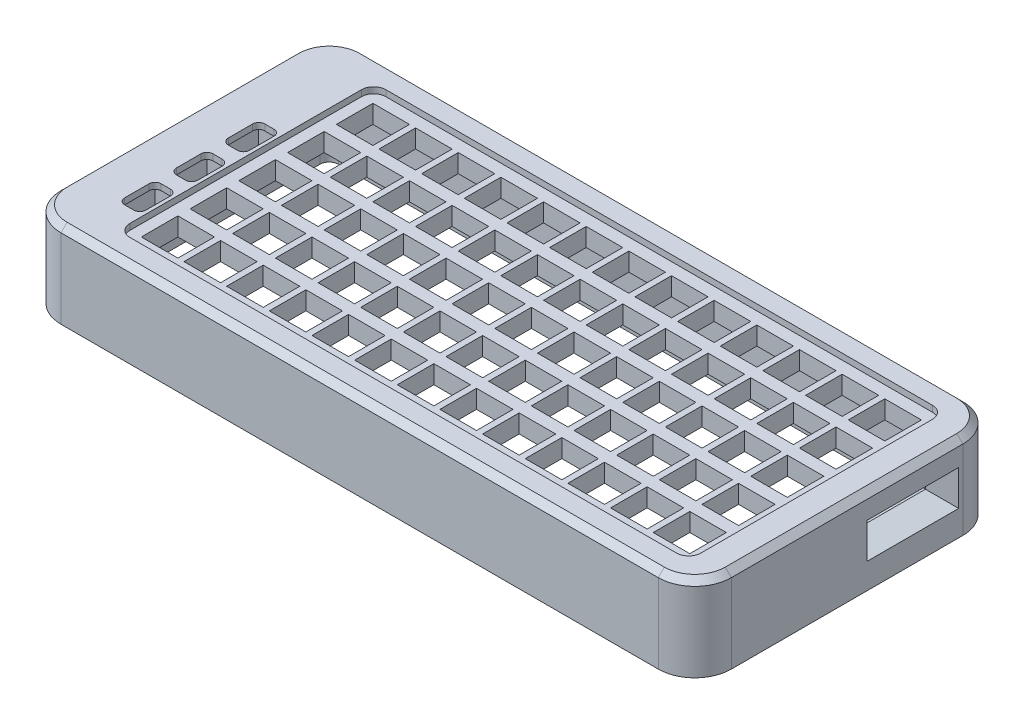
from build123d import *

# Parameters (mm, degrees)
SKETCH_1_W          = 110
SKETCH_1_H          = 50
EXTRUDE_1_DEPTH     = 3
SKETCH_2_W          = 6
SKETCH_2_H          = 6
CUT_EXTRUDE_1_DEPTH = 10
SKETCH_3_W          = 110
SKETCH_3_H          = 50
SKETCH_3_W_2        = 93.7
SKETCH_3_H_2        = 42
EXTRUDE_2_DEPTH     = 1
FILLET_1_R          = 6
CUT_EXTRUDE_2_DEPTH = 6
SKETCH_5_W          = 4.5
SKETCH_5_H          = 7
CUT_EXTRUDE_3_DEPTH = 3
FILLET_2_R          = 2
CHAMFER_1_SIZE      = 1
EXTRUDE_3_DEPTH     = 10
CUT_EXTRUDE_4_DEPTH = 7
CUT_EXTRUDE_5_DEPTH = 3.5
SKETCH_10_W         = 12.104271825
SKETCH_10_H         = 2.912306003
CUT_EXTRUDE_6_DEPTH = 6.5
CHAMFER_2_SIZE      = 4
CHAMFER_2_SIZE2     = 1.455880937
CHAMFER_3_SIZE      = 4
CHAMFER_3_SIZE2     = 1.455880937
CHAMFER_4_SIZE      = 4
CHAMFER_4_SIZE2     = 1.455880937
CHAMFER_5_SIZE      = 4
CHAMFER_5_SIZE2     = 1.455880937
SKETCH_11_R         = 1.55
CUT_EXTRUDE_7_DEPTH = 2


with BuildPart() as part:
    # 草图1 → 凸台-拉伸1 (new body)
    with BuildSketch(Plane(origin=(0, 0, 0), x_dir=(1, 0, 0), z_dir=(0, 1, 0))):
        Rectangle(SKETCH_1_W, SKETCH_1_H)
    extrude(amount=EXTRUDE_1_DEPTH)

    # 草图2 → 切除-拉伸1 (cut)
    with BuildSketch(Plane.XZ):
        with Locations((45.1750889, 8.00003429)):
            Rectangle(SKETCH_2_W, SKETCH_2_H)
        with Locations((45.1750889, 16.00003429)):
            Rectangle(SKETCH_2_W, SKETCH_2_H)
        with Locations((45.1750889, 3.429e-05)):
            Rectangle(SKETCH_2_W, SKETCH_2_H)
        with Locations((45.1750889, -7.99996571)):
            Rectangle(SKETCH_2_W, SKETCH_2_H)
        with Locations((45.1750889, -15.99996571)):
            Rectangle(SKETCH_2_W, SKETCH_2_H)
        with Locations((38.1750889, 8.00003429)):
            Rectangle(SKETCH_2_W, SKETCH_2_H)
        with Locations((38.1750889, 3.429e-05)):
            Rectangle(SKETCH_2_W, SKETCH_2_H)
        with Locations((38.1750889, -7.99996571)):
            Rectangle(SKETCH_2_W, SKETCH_2_H)
        with Locations((38.1750889, -15.99996571)):
            Rectangle(SKETCH_2_W, SKETCH_2_H)
        with Locations((31.1750889, 8.00003429)):
            Rectangle(SKETCH_2_W, SKETCH_2_H)
        with Locations((31.1750889, 3.429e-05)):
            Rectangle(SKETCH_2_W, SKETCH_2_H)
        with Locations((31.1750889, -7.99996571)):
            Rectangle(SKETCH_2_W, SKETCH_2_H)
        with Locations((31.1750889, -15.99996571)):
            Rectangle(SKETCH_2_W, SKETCH_2_H)
        with Locations((24.1750889, 8.00003429)):
            Rectangle(SKETCH_2_W, SKETCH_2_H)
        with Locations((24.1750889, 3.429e-05)):
            Rectangle(SKETCH_2_W, SKETCH_2_H)
        with Locations((24.1750889, -7.99996571)):
            Rectangle(SKETCH_2_W, SKETCH_2_H)
        with Locations((24.1750889, -15.99996571)):
            Rectangle(SKETCH_2_W, SKETCH_2_H)
        with Locations((17.1750889, 8.00003429)):
            Rectangle(SKETCH_2_W, SKETCH_2_H)
        with Locations((17.1750889, 3.429e-05)):
            Rectangle(SKETCH_2_W, SKETCH_2_H)
        with Locations((17.1750889, -7.99996571)):
            Rectangle(SKETCH_2_W, SKETCH_2_H)
        with Locations((17.1750889, -15.99996571)):
            Rectangle(SKETCH_2_W, SKETCH_2_H)
        with Locations((10.1750889, 8.00003429)):
            Rectangle(SKETCH_2_W, SKETCH_2_H)
        with Locations((10.1750889, 3.429e-05)):
            Rectangle(SKETCH_2_W, SKETCH_2_H)
        with Locations((10.1750889, -7.99996571)):
            Rectangle(SKETCH_2_W, SKETCH_2_H)
        with Locations((10.1750889, -15.99996571)):
            Rectangle(SKETCH_2_W, SKETCH_2_H)
        with Locations((3.1750889, 8.00003429)):
            Rectangle(SKETCH_2_W, SKETCH_2_H)
        with Locations((3.1750889, 3.429e-05)):
            Rectangle(SKETCH_2_W, SKETCH_2_H)
        with Locations((3.1750889, -7.99996571)):
            Rectangle(SKETCH_2_W, SKETCH_2_H)
        with Locations((3.1750889, -15.99996571)):
            Rectangle(SKETCH_2_W, SKETCH_2_H)
        with Locations((-3.8249111, 8.00003429)):
            Rectangle(SKETCH_2_W, SKETCH_2_H)
        with Locations((-3.8249111, 3.429e-05)):
            Rectangle(SKETCH_2_W, SKETCH_2_H)
        with Locations((-3.8249111, -7.99996571)):
            Rectangle(SKETCH_2_W, SKETCH_2_H)
        with Locations((-3.8249111, -15.99996571)):
            Rectangle(SKETCH_2_W, SKETCH_2_H)
        with Locations((-10.8249111, 8.00003429)):
            Rectangle(SKETCH_2_W, SKETCH_2_H)
        with Locations((-10.8249111, 3.429e-05)):
            Rectangle(SKETCH_2_W, SKETCH_2_H)
        with Locations((-10.8249111, -7.99996571)):
            Rectangle(SKETCH_2_W, SKETCH_2_H)
        with Locations((-10.8249111, -15.99996571)):
            Rectangle(SKETCH_2_W, SKETCH_2_H)
        with Locations((-17.8249111, 8.00003429)):
            Rectangle(SKETCH_2_W, SKETCH_2_H)
        with Locations((-17.8249111, 3.429e-05)):
            Rectangle(SKETCH_2_W, SKETCH_2_H)
        with Locations((-17.8249111, -7.99996571)):
            Rectangle(SKETCH_2_W, SKETCH_2_H)
        with Locations((-17.8249111, -15.99996571)):
            Rectangle(SKETCH_2_W, SKETCH_2_H)
        with Locations((-24.8249111, 8.00003429)):
            Rectangle(SKETCH_2_W, SKETCH_2_H)
        with Locations((-24.8249111, 3.429e-05)):
            Rectangle(SKETCH_2_W, SKETCH_2_H)
        with Locations((-24.8249111, -7.99996571)):
            Rectangle(SKETCH_2_W, SKETCH_2_H)
        with Locations((-24.8249111, -15.99996571)):
            Rectangle(SKETCH_2_W, SKETCH_2_H)
        with Locations((-31.8249111, 8.00003429)):
            Rectangle(SKETCH_2_W, SKETCH_2_H)
        with Locations((-31.8249111, 3.429e-05)):
            Rectangle(SKETCH_2_W, SKETCH_2_H)
        with Locations((-31.8249111, -7.99996571)):
            Rectangle(SKETCH_2_W, SKETCH_2_H)
        with Locations((-31.8249111, -15.99996571)):
            Rectangle(SKETCH_2_W, SKETCH_2_H)
        with Locations((-38.8249111, 8.00003429)):
            Rectangle(SKETCH_2_W, SKETCH_2_H)
        with Locations((-38.8249111, 3.429e-05)):
            Rectangle(SKETCH_2_W, SKETCH_2_H)
        with Locations((-38.8249111, -7.99996571)):
            Rectangle(SKETCH_2_W, SKETCH_2_H)
        with Locations((-38.8249111, -15.99996571)):
            Rectangle(SKETCH_2_W, SKETCH_2_H)
        with Locations((38.1750889, 16.00003429)):
            Rectangle(SKETCH_2_W, SKETCH_2_H)
        with Locations((31.1750889, 16.00003429)):
            Rectangle(SKETCH_2_W, SKETCH_2_H)
        with Locations((24.1750889, 16.00003429)):
            Rectangle(SKETCH_2_W, SKETCH_2_H)
        with Locations((17.1750889, 16.00003429)):
            Rectangle(SKETCH_2_W, SKETCH_2_H)
        with Locations((10.1750889, 16.00003429)):
            Rectangle(SKETCH_2_W, SKETCH_2_H)
        with Locations((3.1750889, 16.00003429)):
            Rectangle(SKETCH_2_W, SKETCH_2_H)
        with Locations((-3.8249111, 16.00003429)):
            Rectangle(SKETCH_2_W, SKETCH_2_H)
        with Locations((-10.8249111, 16.00003429)):
            Rectangle(SKETCH_2_W, SKETCH_2_H)
        with Locations((-17.8249111, 16.00003429)):
            Rectangle(SKETCH_2_W, SKETCH_2_H)
        with Locations((-24.8249111, 16.00003429)):
            Rectangle(SKETCH_2_W, SKETCH_2_H)
        with Locations((-31.8249111, 16.00003429)):
            Rectangle(SKETCH_2_W, SKETCH_2_H)
        with Locations((-38.8249111, 16.00003429)):
            Rectangle(SKETCH_2_W, SKETCH_2_H)
    extrude(amount=-CUT_EXTRUDE_1_DEPTH, mode=Mode.SUBTRACT)

    # 草图3 → 凸台-拉伸2 (add)
    with BuildSketch(Plane(origin=(0, 3, 0), x_dir=(1, 0, 0), z_dir=(0, 1, 0))):
        Rectangle(SKETCH_3_W, SKETCH_3_H)
        with Locations((3.15, 0)):
            Rectangle(SKETCH_3_W_2, SKETCH_3_H_2, mode=Mode.SUBTRACT)
    extrude(amount=EXTRUDE_2_DEPTH)

    # 圆角1
    fillet_1_edges = [part.edges().sort_by_distance(p)[0] for p in [
        (-55, 2, -25),
        (-55, 2, 25),
        (55, 2, 25),
        (55, 2, -25),
    ]]
    fillet(fillet_1_edges, radius=FILLET_1_R)

    # 草图4 → 切除-拉伸2 (cut)
    with BuildSketch(Plane.XZ):
        with BuildLine():
            Line((-45.261201687, -0.20000635), (-46.761201687, -0.20000635))
            ThreePointArc((-46.761201687, -0.20000635), (-47.468308468, -0.492899569), (-47.761201687, -1.20000635))
            Line((-47.761201687, -1.20000635), (-47.761201687, -5.20000635))
            ThreePointArc((-47.761201687, -5.20000635), (-47.468308468, -5.907113131), (-46.761201687, -6.20000635))
            Line((-46.761201687, -6.20000635), (-45.261201687, -6.20000635))
            ThreePointArc((-45.261201687, -6.20000635), (-44.554094906, -5.907113131), (-44.261201687, -5.20000635))
            Line((-44.261201687, -5.20000635), (-44.261201687, -1.20000635))
            ThreePointArc((-44.261201687, -1.20000635), (-44.554094906, -0.492899569), (-45.261201687, -0.20000635))
        make_face()
        with BuildLine():
            Line((-44.261201687, 7.29999365), (-44.261201687, 3.29999365))
            ThreePointArc((-44.261201687, 3.29999365), (-44.554094906, 2.592886869), (-45.261201687, 2.29999365))
            Line((-45.261201687, 2.29999365), (-46.761201687, 2.29999365))
            ThreePointArc((-46.761201687, 2.29999365), (-47.468308468, 2.592886869), (-47.761201687, 3.29999365))
            Line((-47.761201687, 3.29999365), (-47.761201687, 7.29999365))
            ThreePointArc((-47.761201687, 7.29999365), (-47.468308468, 8.007100431), (-46.761201687, 8.29999365))
            Line((-46.761201687, 8.29999365), (-45.261201687, 8.29999365))
            ThreePointArc((-45.261201687, 8.29999365), (-44.554094906, 8.007100431), (-44.261201687, 7.29999365))
        make_face()
        with BuildLine():
            Line((-44.261201687, 15.79999365), (-44.261201687, 11.79999365))
            ThreePointArc((-44.261201687, 11.79999365), (-44.554094906, 11.092886869), (-45.261201687, 10.79999365))
            Line((-45.261201687, 10.79999365), (-46.761201687, 10.79999365))
            ThreePointArc((-46.761201687, 10.79999365), (-47.468308468, 11.092886869), (-47.761201687, 11.79999365))
            Line((-47.761201687, 11.79999365), (-47.761201687, 15.79999365))
            ThreePointArc((-47.761201687, 15.79999365), (-47.468308468, 16.507100431), (-46.761201687, 16.79999365))
            Line((-46.761201687, 16.79999365), (-45.261201687, 16.79999365))
            ThreePointArc((-45.261201687, 16.79999365), (-44.554094906, 16.507100431), (-44.261201687, 15.79999365))
        make_face()
    extrude(amount=-CUT_EXTRUDE_2_DEPTH, mode=Mode.SUBTRACT)

    # 草图5 → 切除-拉伸3 (cut)
    with BuildSketch(Plane.XZ):
        with Locations((-46.011201687, 5.29999365)):
            Rectangle(SKETCH_5_W, SKETCH_5_H)
        with Locations((-46.011201687, -3.20000635)):
            Rectangle(SKETCH_5_W, SKETCH_5_H)
        with Locations((-46.011201687, 13.79999365)):
            Rectangle(SKETCH_5_W, SKETCH_5_H)
    extrude(amount=-CUT_EXTRUDE_3_DEPTH, mode=Mode.SUBTRACT)

    # 圆角2
    fillet_2_edges = [part.edges().sort_by_distance(p)[0] for p in [
        (50, 3.5, 21),
        (50, 3.5, -21),
        (-43.7, 3.5, -21),
        (-43.7, 3.5, 21),
    ]]
    fillet(fillet_2_edges, radius=FILLET_2_R)

    # 倒角1
    chamfer_1_edges = [part.edges().sort_by_distance(p)[0] for p in [
        (53.242640687, 4, -23.242640687),
        (0, 4, -25),
        (55, 4, 0),
        (-53.242640687, 4, -23.242640687),
        (53.242640687, 4, 23.242640687),
        (-55, 4, 0),
        (0, 4, 25),
        (-53.242640687, 4, 23.242640687),
    ]]
    chamfer(chamfer_1_edges, length=CHAMFER_1_SIZE)

    # 草图6 → 凸台-拉伸3 (add)
    with BuildSketch(Plane.XZ):
        with BuildLine():
            Line((-55, 19), (-55, -19))
            ThreePointArc((-55, -19), (-53.242640687, -23.242640687), (-49, -25))
            Line((-49, -25), (49, -25))
            ThreePointArc((49, -25), (53.242640687, -23.242640687), (55, -19))
            Line((55, -19), (55, 19))
            ThreePointArc((55, 19), (53.242640687, 23.242640687), (49, 25))
            Line((49, 25), (-49, 25))
            ThreePointArc((-49, 25), (-53.242640687, 23.242640687), (-55, 19))
        make_face()
        with BuildLine():
            Line((50.5, 19), (50.5, -19))
            ThreePointArc((50.5, -19), (50.060660172, -20.060660172), (49, -20.5))
            Line((49, -20.5), (-49, -20.5))
            ThreePointArc((-49, -20.5), (-50.060660172, -20.060660172), (-50.5, -19))
            Line((-50.5, -19), (-50.5, 19))
            ThreePointArc((-50.5, 19), (-50.060660172, 20.060660172), (-49, 20.5))
            Line((-49, 20.5), (49, 20.5))
            ThreePointArc((49, 20.5), (50.060660172, 20.060660172), (50.5, 19))
        make_face(mode=Mode.SUBTRACT)
    extrude(amount=EXTRUDE_3_DEPTH)

    # 草图8 → 切除-拉伸4 (cut)
    with BuildSketch(Plane(origin=(-50.5, 0, 0), x_dir=(0, 0, -1), z_dir=(1, 0, 0))):
        with BuildLine():
            Line((14.684129805, -5.028501584), (8.683914391, -5.028501584))
            ThreePointArc((8.683914391, -5.028501584), (6.935463557, -3.28005075), (8.683914391, -1.531599916))
            Line((8.683914391, -1.531599916), (14.684129805, -1.531599916))
            ThreePointArc((14.684129805, -1.531599916), (16.432580639, -3.28005075), (14.684129805, -5.028501584))
        make_face()
    extrude(amount=-CUT_EXTRUDE_4_DEPTH, mode=Mode.SUBTRACT)

    # 草图9 → 切除-拉伸5 (cut)
    with BuildSketch(Plane.ZY.offset(55)):
        with BuildLine():
            Line((-15.088320827, -0.03005075), (-8.279723369, -0.03005075))
            ThreePointArc((-8.279723369, -0.03005075), (-5.029723369, -3.28005075), (-8.279723369, -6.53005075))
            Line((-8.279723369, -6.53005075), (-15.088320827, -6.53005075))
            ThreePointArc((-15.088320827, -6.53005075), (-18.338320827, -3.28005075), (-15.088320827, -0.03005075))
        make_face()
    extrude(amount=-CUT_EXTRUDE_5_DEPTH, mode=Mode.SUBTRACT)

    # 草图10 → 切除-拉伸6 (cut)
    with BuildSketch(Plane.ZY.offset(-50.5)):
        with Locations((-10.796340626, -2.900297793)):
            Rectangle(SKETCH_10_W, SKETCH_10_H)
    extrude(amount=-CUT_EXTRUDE_6_DEPTH, mode=Mode.SUBTRACT)

    # 倒角2
    chamfer_2_edges = [part.edges().sort_by_distance(p)[0] for p in [
        (55, -1.444144791, -10.796340625),
    ]]
    chamfer_2_side = [part.faces().sort_by_distance(p)[0] for p in [
        (52.75, -1.444144791, -10.796340625),
    ]]
    chamfer(chamfer_2_edges, length=CHAMFER_2_SIZE, length2=CHAMFER_2_SIZE2, reference=chamfer_2_side[0])

    # 倒角3
    chamfer_3_edges = [part.edges().sort_by_distance(p)[0] for p in [
        (55, -4.356450794, -10.796340625),
    ]]
    chamfer_3_side = [part.faces().sort_by_distance(p)[0] for p in [
        (52.75, -4.356450794, -10.796340625),
    ]]
    chamfer(chamfer_3_edges, length=CHAMFER_3_SIZE, length2=CHAMFER_3_SIZE2, reference=chamfer_3_side[0])

    # 倒角4
    chamfer_4_edges = [part.edges().sort_by_distance(p)[0] for p in [
        (55, -2.900297793, -4.744204713),
    ]]
    chamfer_4_side = [part.faces().sort_by_distance(p)[0] for p in [
        (53.032014797, -2.900297793, -4.744204713),
    ]]
    chamfer(chamfer_4_edges, length=CHAMFER_4_SIZE, length2=CHAMFER_4_SIZE2, reference=chamfer_4_side[0])

    # 倒角5
    chamfer_5_edges = [part.edges().sort_by_distance(p)[0] for p in [
        (55, -2.900297793, -16.848476538),
    ]]
    chamfer_5_side = [part.faces().sort_by_distance(p)[0] for p in [
        (53.032014797, -2.900297793, -16.848476538),
    ]]
    chamfer(chamfer_5_edges, length=CHAMFER_5_SIZE, length2=CHAMFER_5_SIZE2, reference=chamfer_5_side[0])

    # 草图11 → 切除-拉伸7 (cut)
    with BuildSketch(Plane.XZ.offset(10)):
        with Locations((0, -22.7)):
            Circle(SKETCH_11_R)
        with Locations((20, -22.7)):
            Circle(SKETCH_11_R)
        with Locations((40, -22.7)):
            Circle(SKETCH_11_R)
        with Locations((-20, -22.7)):
            Circle(SKETCH_11_R)
        with Locations((-40, -22.7)):
            Circle(SKETCH_11_R)
        with Locations((-40, 22.7)):
            Circle(SKETCH_11_R)
        with Locations((-20, 22.7)):
            Circle(SKETCH_11_R)
        with Locations((40, 22.7)):
            Circle(SKETCH_11_R)
        with Locations((20, 22.7)):
            Circle(SKETCH_11_R)
        with Locations((0, 22.7)):
            Circle(SKETCH_11_R)
    extrude(amount=-CUT_EXTRUDE_7_DEPTH, mode=Mode.SUBTRACT)


solid = part.part
